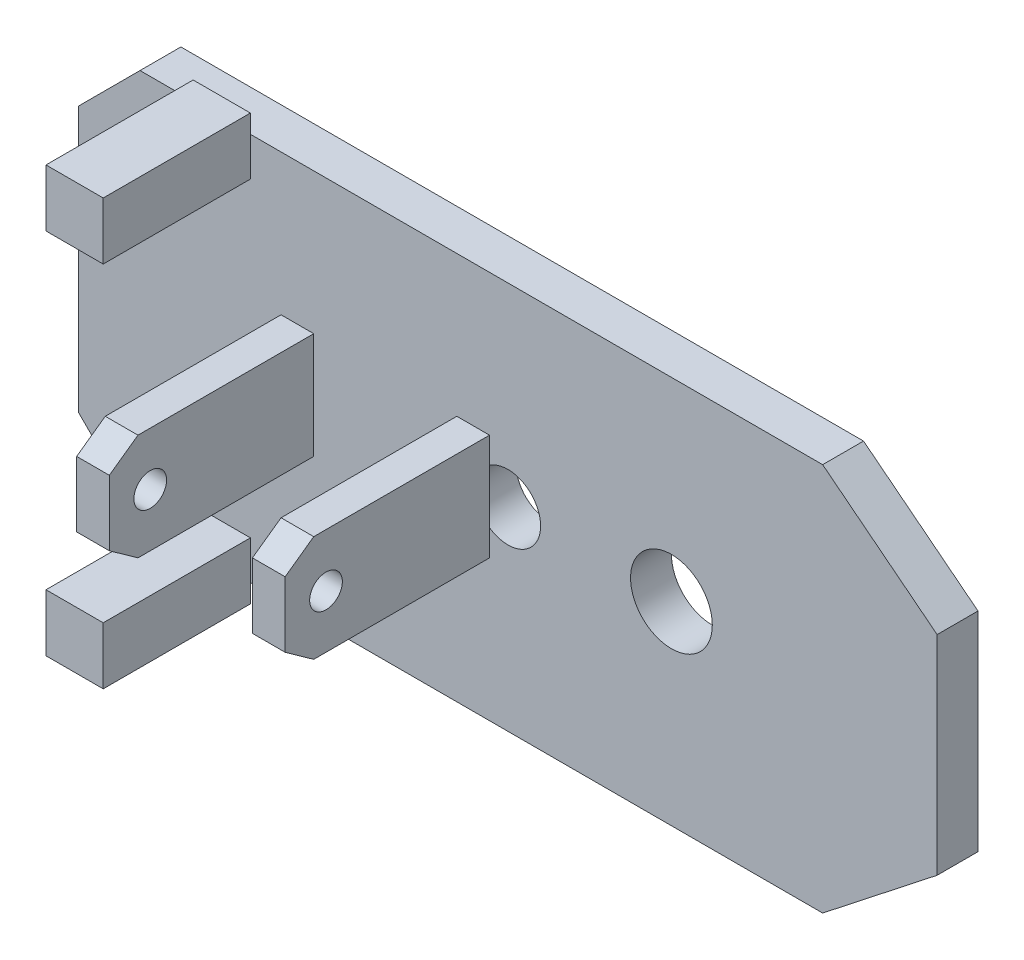
from build123d import *

# Parameters (mm, degrees)
SK_SOLE_PLATE_R    = 10
SK_SOLE_PLATE_R_2  = 8
SOLE_PLATE_DEPTH   = 10
SK_CLEVIS_FRONT_R  = 4
CLEVIS_FRONT_DEPTH = 8
SK_CLEVIS_BACK_R   = 4
CLEVIS_BACK_DEPTH  = 8
SK_POST_LAT_W      = 14
SK_POST_LAT_H      = 14
POST_LAT_DEPTH     = 36
SK_POST_MED_W      = 14
SK_POST_MED_H      = 14
POST_MED_DEPTH     = 36


with BuildPart() as part:
    # SK_Sole_Plate → Sole_Plate (new body)
    with BuildSketch(Plane.XY.offset(-50)):
        Polygon((-60, 47.5), (107, 47.5), (135, 25.5), (135, -25.5), (107, -47.5), (-60, -47.5), (-75, -32.5), (-75, 32.5), align=None)
        with Locations((70, 0)):
            Circle(SK_SOLE_PLATE_R, mode=Mode.SUBTRACT)
        with Locations((30, 0)):
            Circle(SK_SOLE_PLATE_R_2, mode=Mode.SUBTRACT)
    extrude(amount=SOLE_PLATE_DEPTH)

    # SK_Clevis_Front → Clevis_Front (add)
    with BuildSketch(Plane(origin=(17.5, 0, 0), x_dir=(0, 0, -1), z_dir=(1, 0, 0))):
        Polygon((40, 13), (40, -13), (-3, -13), (-10, -8), (-10, 8), (-3, 13), align=None)
        Circle(SK_CLEVIS_FRONT_R, mode=Mode.SUBTRACT)
    extrude(amount=CLEVIS_FRONT_DEPTH)

    # SK_Clevis_Back → Clevis_Back (add)
    with BuildSketch(Plane(origin=(-25.5, 0, 0), x_dir=(0, 0, -1), z_dir=(1, 0, 0))):
        Polygon((40, 13), (40, -13), (-3, -13), (-10, -8), (-10, 8), (-3, 13), align=None)
        Circle(SK_CLEVIS_BACK_R, mode=Mode.SUBTRACT)
    extrude(amount=CLEVIS_BACK_DEPTH)

    # SK_Post_Lat → Post_Lat (add)
    with BuildSketch(Plane.XY.offset(-40)):
        with Locations((-40, -45)):
            Rectangle(SK_POST_LAT_W, SK_POST_LAT_H)
    extrude(amount=POST_LAT_DEPTH)

    # SK_Post_Med → Post_Med (add)
    with BuildSketch(Plane.XY.offset(-40)):
        with Locations((-40, 45)):
            Rectangle(SK_POST_MED_W, SK_POST_MED_H)
    extrude(amount=POST_MED_DEPTH)


solid = part.part
